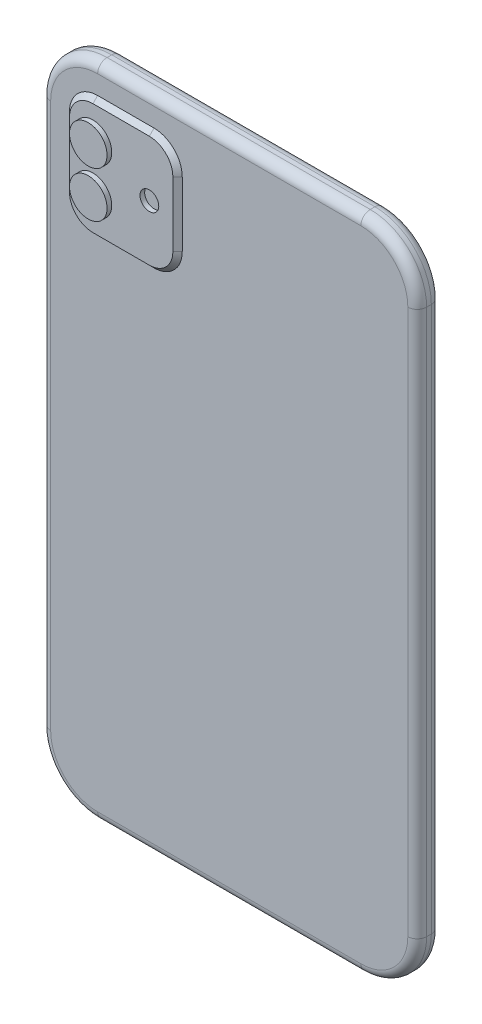
from build123d import *

# Parameters (mm, degrees)
SKETCH1_W            = 101.6
SKETCH1_H            = 177.8
BOSS_EXTRUDE2_DEPTH  = 6.35
FILLET1_R            = 15.24
BOSS_EXTRUDE5_DEPTH  = 0.508
CUT_EXTRUDE1_DEPTH   = 0.254
FILLET3_R            = 2.54
FILLET4_R            = 2.54
BOSS_EXTRUDE7_DEPTH  = 1.27
SKETCH6_R            = 5.08
BOSS_EXTRUDE10_DEPTH = 1.27
SKETCH7_R            = 2.54
CUT_EXTRUDE2_DEPTH   = 1.27
CHAMFER1_SIZE        = 1.27
CUT_EXTRUDE6_DEPTH   = 6.35


with BuildPart() as part:
    # Sketch1 → Boss-Extrude2 (new body)
    with BuildSketch(Plane.XY):
        Rectangle(SKETCH1_W, SKETCH1_H)
    extrude(amount=BOSS_EXTRUDE2_DEPTH)

    # Fillet1
    fillet1_edges = [part.edges().sort_by_distance(p)[0] for p in [
        (50.8, -88.9, 3.175),
        (-50.8, -88.9, 3.175),
        (-50.8, 88.9, 3.175),
        (50.8, 88.9, 3.175),
    ]]
    fillet(fillet1_edges, radius=FILLET1_R)

    # Sketch2 → Boss-Extrude5 (add)
    with BuildSketch(Plane.XY):
        with BuildLine():
            Line((12.7, 76.2), (-12.7, 76.2))
            ThreePointArc((-12.7, 76.2), (-16.292102448, 77.687897552), (-17.78, 81.28))
            Line((-17.78, 81.28), (-17.78, 86.36))
            Line((-17.78, 86.36), (-35.56, 86.36))
            ThreePointArc((-35.56, 86.36), (-44.540256121, 82.640256121), (-48.26, 73.66))
            Line((-48.26, 73.66), (-48.26, -73.66))
            ThreePointArc((-48.26, -73.66), (-44.540256121, -82.640256121), (-35.56, -86.36))
            Line((-35.56, -86.36), (35.56, -86.36))
            ThreePointArc((35.56, -86.36), (44.540256121, -82.640256121), (48.26, -73.66))
            Line((48.26, -73.66), (48.26, 73.66))
            ThreePointArc((48.26, 73.66), (44.540256121, 82.640256121), (35.56, 86.36))
            Line((35.56, 86.36), (17.78, 86.36))
            Line((17.78, 86.36), (17.78, 81.28))
            ThreePointArc((17.78, 81.28), (16.292102448, 77.687897552), (12.7, 76.2))
        make_face()
    extrude(amount=-BOSS_EXTRUDE5_DEPTH)

    # Sketch3 → Cut-Extrude1 (cut)
    with BuildSketch(Plane.XY):
        with BuildLine():
            Line((5.08, 81.26519761), (-5.08, 81.26519761))
            ThreePointArc((-5.08, 81.26519761), (-6.35, 82.53519761), (-5.08, 83.80519761))
            Line((-5.08, 83.80519761), (5.08, 83.80519761))
            ThreePointArc((5.08, 83.80519761), (6.35, 82.53519761), (5.08, 81.26519761))
        make_face()
    extrude(amount=CUT_EXTRUDE1_DEPTH, mode=Mode.SUBTRACT)

    # Fillet3
    fillet3_edges = [part.edges().sort_by_distance(p)[0] for p in [
        (0, -88.9, 0),
        (50.8, 0, 0),
        (-50.8, 0, 0),
        (0, 88.9, 0),
        (-46.336307345, 84.436307345, 0),
        (46.336307345, 84.436307345, 0),
        (46.336307345, -84.436307345, 0),
        (-46.336307345, -84.436307345, 0),
    ]]
    fillet(fillet3_edges, radius=FILLET3_R - 0.0001)  # a hair under: the kernel refuses the full size

    # Fillet4
    fillet4_edges = [part.edges().sort_by_distance(p)[0] for p in [
        (0, -88.9, 6.35),
        (-50.8, 0, 6.35),
        (50.8, 0, 6.35),
        (0, 88.9, 6.35),
        (-46.336307345, 84.436307345, 6.35),
        (46.336307345, 84.436307345, 6.35),
        (46.336307345, -84.436307345, 6.35),
        (-46.336307345, -84.436307345, 6.35),
    ]]
    fillet(fillet4_edges, radius=FILLET4_R)

    # Sketch4 → Boss-Extrude7 (add)
    with BuildSketch(Plane.XY.offset(6.35)):
        with BuildLine():
            Line((-12.7, 73.66), (-12.7, 56.173421011))
            ThreePointArc((-12.7, 56.173421011), (-14.931846327, 50.785267338), (-20.32, 48.553421011))
            Line((-20.32, 48.553421011), (-35.56, 48.553421011))
            ThreePointArc((-35.56, 48.553421011), (-40.948153673, 50.785267338), (-43.18, 56.173421011))
            Line((-43.18, 56.173421011), (-43.18, 73.66))
            ThreePointArc((-43.18, 73.66), (-40.948153673, 79.048153673), (-35.56, 81.28))
            Line((-35.56, 81.28), (-20.32, 81.28))
            ThreePointArc((-20.32, 81.28), (-14.931846327, 79.048153673), (-12.7, 73.66))
        make_face()
    extrude(amount=BOSS_EXTRUDE7_DEPTH)

    # Sketch6 → Boss-Extrude10 (add)
    with BuildSketch(Plane.XY.offset(7.62)):
        with Locations(Location((-35.56, 58.713421011, 0), (0, 0, 180))):
            Circle(SKETCH6_R)
        with Locations(Location((-35.56, 71.12, 0), (0, 0, 180))):
            Circle(SKETCH6_R)
    extrude(amount=BOSS_EXTRUDE10_DEPTH)

    # Sketch7 → Cut-Extrude2 (cut)
    with BuildSketch(Plane.XY.offset(7.62)):
        with Locations((-20.32, 64.916710506)):
            Circle(SKETCH7_R)
    extrude(amount=-CUT_EXTRUDE2_DEPTH, mode=Mode.SUBTRACT)

    # Chamfer1
    chamfer1_edges = [part.edges().sort_by_distance(p)[0] for p in [
        (-27.94, 81.28, 7.62),
        (-14.931846327, 79.048153673, 7.62),
        (-12.7, 64.916710506, 7.62),
        (-14.931846327, 50.785267338, 7.62),
        (-27.94, 48.553421011, 7.62),
        (-40.948153673, 50.785267338, 7.62),
        (-43.18, 64.916710506, 7.62),
        (-40.948153673, 79.048153673, 7.62),
    ]]
    chamfer(chamfer1_edges, length=CHAMFER1_SIZE - 0.0001)  # a hair under: the kernel refuses the full size

    # Sketch9 → Cut-Extrude6 (cut)
    with BuildSketch(Plane(origin=(0, -88.9, 0), x_dir=(1, 0, 0), z_dir=(0, 1, 0))):
        with BuildLine():
            Line((5.017161758, -3.762137851), (-5.017161758, -3.762137851))
            ThreePointArc((-5.017161758, -3.762137851), (-5.604299609, -3.175), (-5.017161758, -2.587862149))
            Line((-5.017161758, -2.587862149), (5.017161758, -2.587862149))
            ThreePointArc((5.017161758, -2.587862149), (5.604299609, -3.175), (5.017161758, -3.762137851))
        make_face()
    extrude(amount=CUT_EXTRUDE6_DEPTH, mode=Mode.SUBTRACT)


solid = part.part
